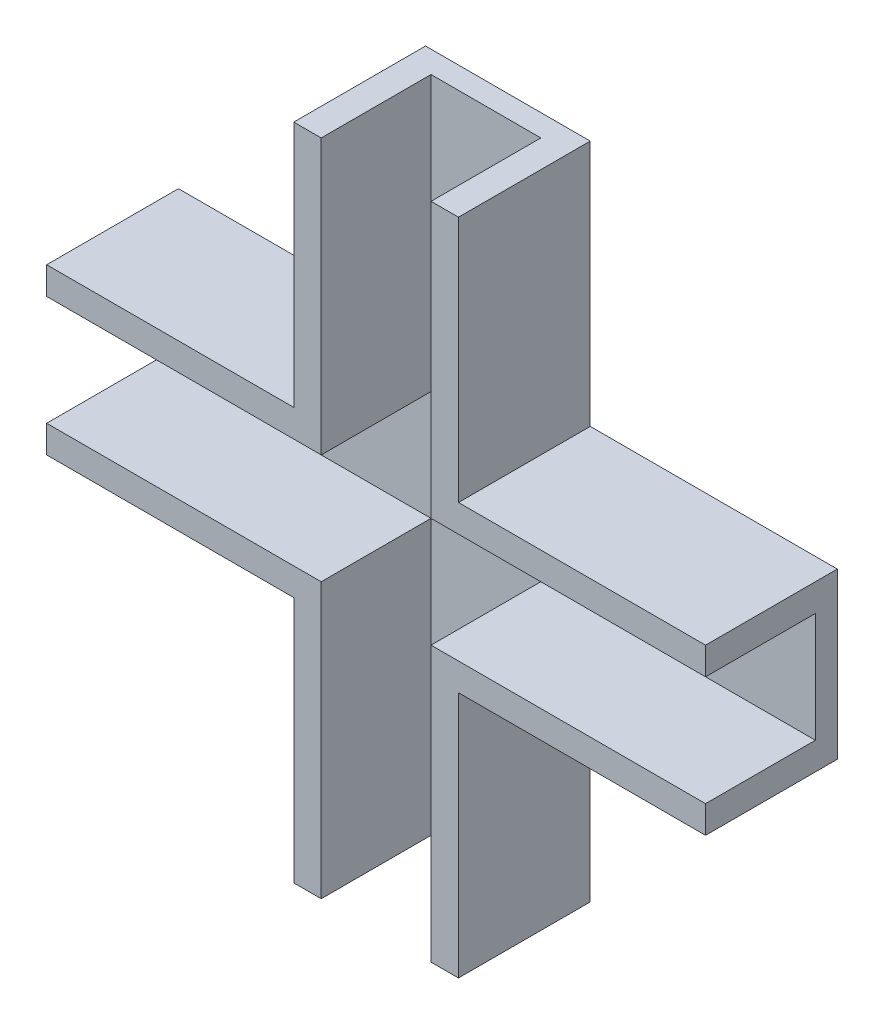
from build123d import *

# Parameters (mm, degrees)
BOSS_EXTRUDE1_DEPTH = 6
CUT_EXTRUDE1_DEPTH  = 5


with BuildPart() as part:
    # Sketch1 → Boss-Extrude1 (new body)
    with BuildSketch(Plane.XY):
        Polygon((-15, 3.75), (-3.75, 3.75), (-3.75, 15), (3.75, 15), (3.75, 3.75), (15, 3.75), (15, -3.75), (3.75, -3.75), (3.75, -15), (-3.75, -15), (-3.75, -3.75), (-15, -3.75), align=None)
    extrude(amount=BOSS_EXTRUDE1_DEPTH)

    # Sketch3 → Cut-Extrude1 (cut)
    with BuildSketch(Plane.XY.offset(6)):
        Polygon((-15, 2.5), (-15, -2.5), (-2.5, -2.5), (-2.5, -15), (2.5, -15), (2.5, -2.5), (15, -2.5), (15, 2.5), (2.5, 2.5), (2.5, 15), (-2.5, 15), (-2.5, 2.5), align=None)
    extrude(amount=-CUT_EXTRUDE1_DEPTH, mode=Mode.SUBTRACT)


solid = part.part
